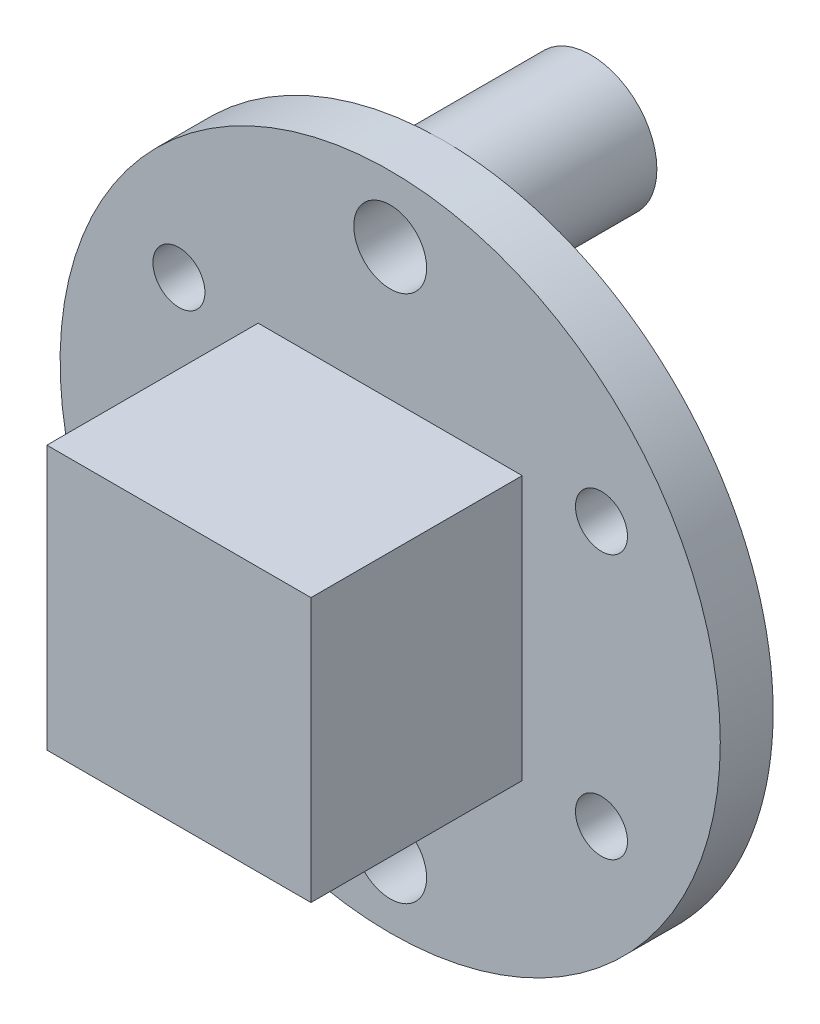
from build123d import *

# Parameters (mm, degrees)
SKETCH1_R           = 15.875
SKETCH1_R_2         = 1.75
SKETCH1_R_3         = 1.25
BOSS_EXTRUDE1_DEPTH = 2.54
BOSS_EXTRUDE2_START = -7.110000004
SKETCH1_3_R         = 3.175
SKETCH1_3_R_2       = 1.75
BOSS_EXTRUDE2_DEPTH = 7.110000004
SKETCH2_W           = 12.7
SKETCH2_H           = 12.7
BOSS_EXTRUDE3_DEPTH = 10.16


with BuildPart() as part:
    # Sketch1 → Boss-Extrude1 (new body)
    with BuildSketch(Plane.XY):
        Circle(SKETCH1_R)
        with Locations((0, 12.7)):
            Circle(SKETCH1_R_2, mode=Mode.SUBTRACT)
        with Locations((-10.16, -6.35)):
            Circle(SKETCH1_R_3, mode=Mode.SUBTRACT)
        with Locations((10.16, -6.35)):
            Circle(SKETCH1_R_3, mode=Mode.SUBTRACT)
        with Locations((-10.16, 6.35)):
            Circle(SKETCH1_R_3, mode=Mode.SUBTRACT)
        with Locations((10.16, 6.35)):
            Circle(SKETCH1_R_3, mode=Mode.SUBTRACT)
        with Locations((0, -12.7)):
            Circle(SKETCH1_R_2, mode=Mode.SUBTRACT)
    extrude(amount=BOSS_EXTRUDE1_DEPTH)

    # Sketch1<3> → Boss-Extrude2 (add)
    # profile 1 of 2: a face of its own
    with BuildSketch(Plane.XY.offset(BOSS_EXTRUDE2_START)):
        with Locations((0, 12.7)):
            Circle(SKETCH1_3_R)
        with Locations((0, 12.7)):
            Circle(SKETCH1_3_R_2, mode=Mode.SUBTRACT)
    # profile 2 of 2: a face of its own
    with BuildSketch(Plane.XY.offset(BOSS_EXTRUDE2_START)):
        with Locations((0, -12.7)):
            Circle(SKETCH1_3_R)
        with Locations((0, -12.7)):
            Circle(SKETCH1_3_R_2, mode=Mode.SUBTRACT)
    extrude(amount=BOSS_EXTRUDE2_DEPTH)

    # Sketch2 → Boss-Extrude3 (add)
    with BuildSketch(Plane.XY.offset(2.54)):
        Rectangle(SKETCH2_W, SKETCH2_H)
    extrude(amount=BOSS_EXTRUDE3_DEPTH)


solid = part.part
